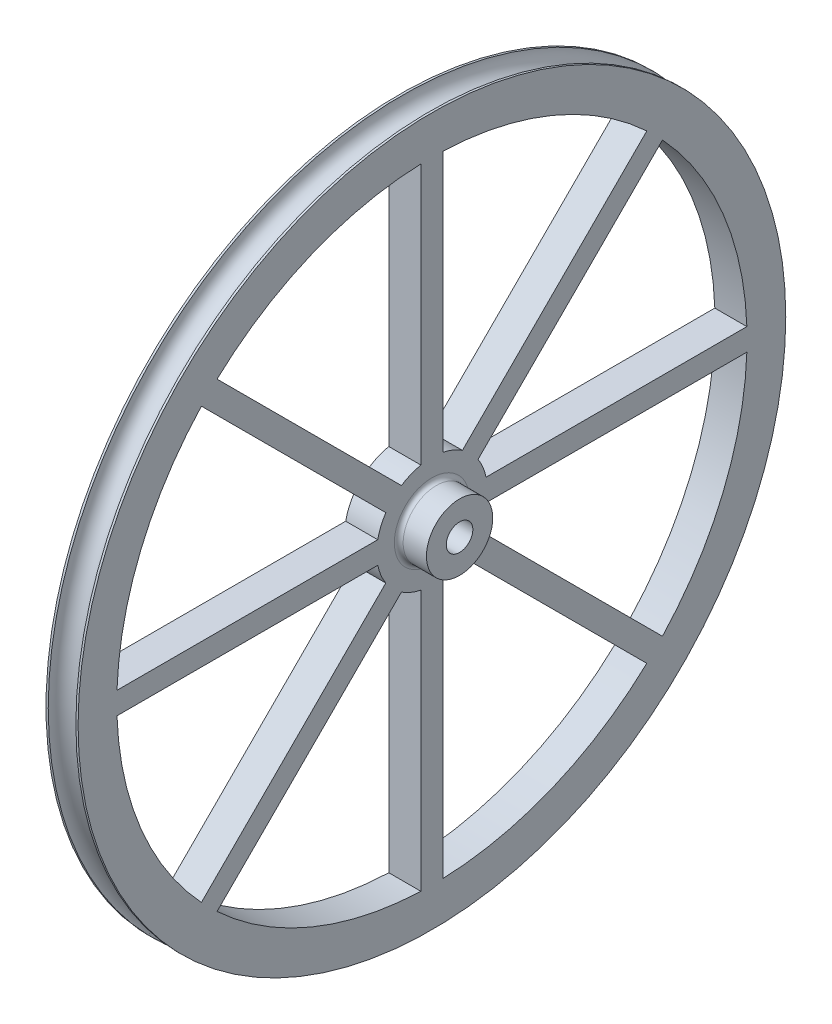
from build123d import *

# Parameters (mm, degrees)
SKETCH1_R           = 40.64
BOSS_EXTRUDE1_DEPTH = 3.683
SKETCH10_R          = 1.5875
CUT_EXTRUDE3_DEPTH  = 58.591524455
SKETCH12_R          = 1.524
CUT_EXTRUDE4_DEPTH  = 58.591524455
BOSS_EXTRUDE2_START = 3.175
SKETCH13_R          = 3.81
SKETCH13_R_2        = 1.524
BOSS_EXTRUDE2_DEPTH = 3.175
FILLET1_R           = 0.508


with BuildPart() as part:
    # Sketch1 → Boss-Extrude1 (new body)
    with BuildSketch(Plane(origin=(0, 0, 0), x_dir=(0, 0, -1), z_dir=(1, 0, 0))):
        Circle(SKETCH1_R)
    extrude(amount=BOSS_EXTRUDE1_DEPTH)

    # Sketch10 → Cut-Revolve1 (revolve, cut)
    with BuildSketch(Plane.XY):
        with Locations((1.8415, 40.64)):
            Circle(SKETCH10_R)
    revolve(axis=Axis((-1.01619145, 0, 0), (1, 0, 0)), mode=Mode.SUBTRACT)

    # Sketch11 → Cut-Extrude3 (cut, through all)
    with BuildSketch(Plane(origin=(3.683, 0, 0), x_dir=(0, 0, -1), z_dir=(1, 0, 0))):
        with BuildLine():
            Line((-1.27, 36.172712436), (-1.27, 6.221703947))
            ThreePointArc((-1.27, 6.221703947), (-2.430039796, 5.866635031), (-3.501383439, 5.297434663))
            Line((-3.501383439, 5.297434663), (-24.679944646, 26.47599587))
            ThreePointArc((-24.679944646, 26.47599587), (-13.851226834, 33.439819679), (-1.27, 36.172712436))
        make_face()
        with BuildLine():
            Line((1.27, 36.172712436), (1.27, 6.221703947))
            ThreePointArc((1.27, 6.221703947), (2.430039796, 5.866635031), (3.501383439, 5.297434663))
            Line((3.501383439, 5.297434663), (24.679944646, 26.47599587))
            ThreePointArc((24.679944646, 26.47599587), (13.851226834, 33.439819679), (1.27, 36.172712436))
        make_face()
        with BuildLine():
            Line((26.47599587, 24.679944646), (5.297434663, 3.501383439))
            ThreePointArc((5.297434663, 3.501383439), (5.866635031, 2.430039796), (6.221703947, 1.27))
            Line((6.221703947, 1.27), (36.172712436, 1.27))
            ThreePointArc((36.172712436, 1.27), (33.439819679, 13.851226834), (26.47599587, 24.679944646))
        make_face()
        with BuildLine():
            Line((36.172712436, -1.27), (6.221703947, -1.27))
            ThreePointArc((6.221703947, -1.27), (5.866635031, -2.430039796), (5.297434663, -3.501383439))
            Line((5.297434663, -3.501383439), (26.47599587, -24.679944646))
            ThreePointArc((26.47599587, -24.679944646), (33.439819679, -13.851226834), (36.172712436, -1.27))
        make_face()
        with BuildLine():
            Line((24.679944646, -26.47599587), (3.501383439, -5.297434663))
            ThreePointArc((3.501383439, -5.297434663), (2.430039796, -5.866635031), (1.27, -6.221703947))
            Line((1.27, -6.221703947), (1.27, -36.172712436))
            ThreePointArc((1.27, -36.172712436), (13.851226834, -33.439819679), (24.679944646, -26.47599587))
        make_face()
        with BuildLine():
            Line((-1.27, -36.172712436), (-1.27, -6.221703947))
            ThreePointArc((-1.27, -6.221703947), (-2.430039796, -5.866635031), (-3.501383439, -5.297434663))
            Line((-3.501383439, -5.297434663), (-24.679944646, -26.47599587))
            ThreePointArc((-24.679944646, -26.47599587), (-13.851226834, -33.439819679), (-1.27, -36.172712436))
        make_face()
        with BuildLine():
            Line((-26.47599587, -24.679944646), (-5.297434663, -3.501383439))
            ThreePointArc((-5.297434663, -3.501383439), (-5.866635031, -2.430039796), (-6.221703947, -1.27))
            Line((-6.221703947, -1.27), (-36.172712436, -1.27))
            ThreePointArc((-36.172712436, -1.27), (-33.439819679, -13.851226834), (-26.47599587, -24.679944646))
        make_face()
        with BuildLine():
            Line((-36.172712436, 1.27), (-6.221703947, 1.27))
            ThreePointArc((-6.221703947, 1.27), (-5.866635031, 2.430039796), (-5.297434663, 3.501383439))
            Line((-5.297434663, 3.501383439), (-26.47599587, 24.679944646))
            ThreePointArc((-26.47599587, 24.679944646), (-33.439819679, 13.851226834), (-36.172712436, 1.27))
        make_face()
    extrude(amount=-CUT_EXTRUDE3_DEPTH, mode=Mode.SUBTRACT)

    # Sketch12 → Cut-Extrude4 (cut, through all)
    with BuildSketch(Plane(origin=(3.683, 0, 0), x_dir=(0, 0, -1), z_dir=(1, 0, 0))):
        Circle(SKETCH12_R)
    extrude(amount=-CUT_EXTRUDE4_DEPTH, mode=Mode.SUBTRACT)

    # Sketch13 → Boss-Extrude2 (add)
    with BuildSketch(Plane(origin=(3.683, 0, 0), x_dir=(0, 0, -1), z_dir=(1, 0, 0)).offset(BOSS_EXTRUDE2_START)):
        Circle(SKETCH13_R)
        Circle(SKETCH13_R_2, mode=Mode.SUBTRACT)
    extrude(amount=-BOSS_EXTRUDE2_DEPTH)

    # Fillet1
    fillet1_edges = [part.edges().sort_by_distance(p)[0] for p in [
        (3.683, 0, 3.81),
    ]]
    fillet(fillet1_edges, radius=FILLET1_R)


solid = part.part
